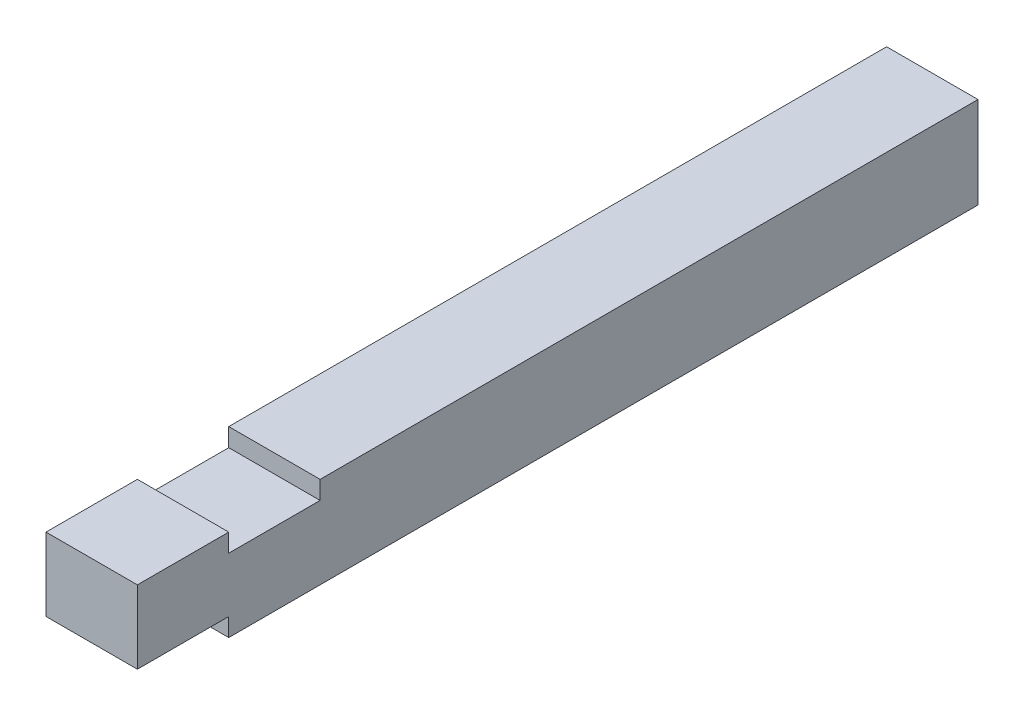
from build123d import *

# Parameters (mm, degrees)
ESQUISSE1_W             = 10
ESQUISSE1_H             = 10
BOSS_EXTRU_1_DEPTH      = 92
ESQUISSE2_W             = 10
ESQUISSE2_H             = 10
ENL_V_MAT_EXTRU_1_DEPTH = 2
ESQUISSE3_W             = 10
ESQUISSE3_H             = 10
ENL_V_MAT_EXTRU_2_DEPTH = 2


with BuildPart() as part:
    # Esquisse1 → Boss.-Extru.1 (new body)
    with BuildSketch(Plane.XY):
        with Locations((5, 5)):
            Rectangle(ESQUISSE1_W, ESQUISSE1_H)
    extrude(amount=BOSS_EXTRU_1_DEPTH)

    # Esquisse2 → Enlèv. mat.-Extru.1 (cut)
    with BuildSketch(Plane.XZ):
        with Locations((5, 87)):
            Rectangle(ESQUISSE2_W, ESQUISSE2_H)
    extrude(amount=-ENL_V_MAT_EXTRU_1_DEPTH, mode=Mode.SUBTRACT)

    # Esquisse3 → Enlèv. mat.-Extru.2 (cut)
    with BuildSketch(Plane(origin=(0, 10, 0), x_dir=(1, 0, 0), z_dir=(0, 1, 0))):
        with Locations((5, -77)):
            Rectangle(ESQUISSE3_W, ESQUISSE3_H)
    extrude(amount=-ENL_V_MAT_EXTRU_2_DEPTH, mode=Mode.SUBTRACT)


solid = part.part
